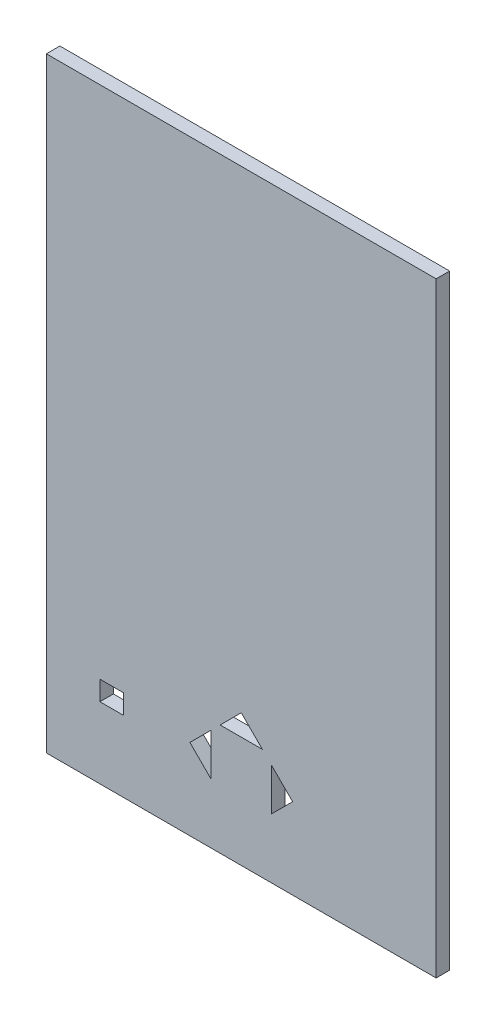
from build123d import *

# Parameters (mm, degrees)
SKETCH1_W           = 183.525
SKETCH1_H           = 285.125
BOSS_EXTRUDE1_DEPTH = 6.35
SKETCH2_W           = 11.200000206
SKETCH2_H           = 9.200000142
CUT_EXTRUDE1_DEPTH  = 170.660676978


with BuildPart() as part:
    # Sketch1 → Boss-Extrude1 (new body)
    with BuildSketch(Plane.XY):
        Rectangle(SKETCH1_W, SKETCH1_H)
    extrude(amount=-BOSS_EXTRUDE1_DEPTH)

    # Sketch2 → Cut-Extrude1 (cut, through all)
    with BuildSketch(Plane.XY):
        Polygon((24.182851904, -104.4625), (14.236910358, -94.516558454), (14.236910358, -114.408441546), align=None)
        Polygon((0, -80.279648096), (-9.945941546, -90.225589642), (9.945941546, -90.225589642), align=None)
        Polygon((-24.182851904, -104.4625), (-14.236910358, -114.408441546), (-14.236910358, -94.516558454), align=None)
        with Locations((-60.96, -104.4625)):
            Rectangle(SKETCH2_W, SKETCH2_H)
    extrude(amount=-CUT_EXTRUDE1_DEPTH, mode=Mode.SUBTRACT)


solid = part.part
